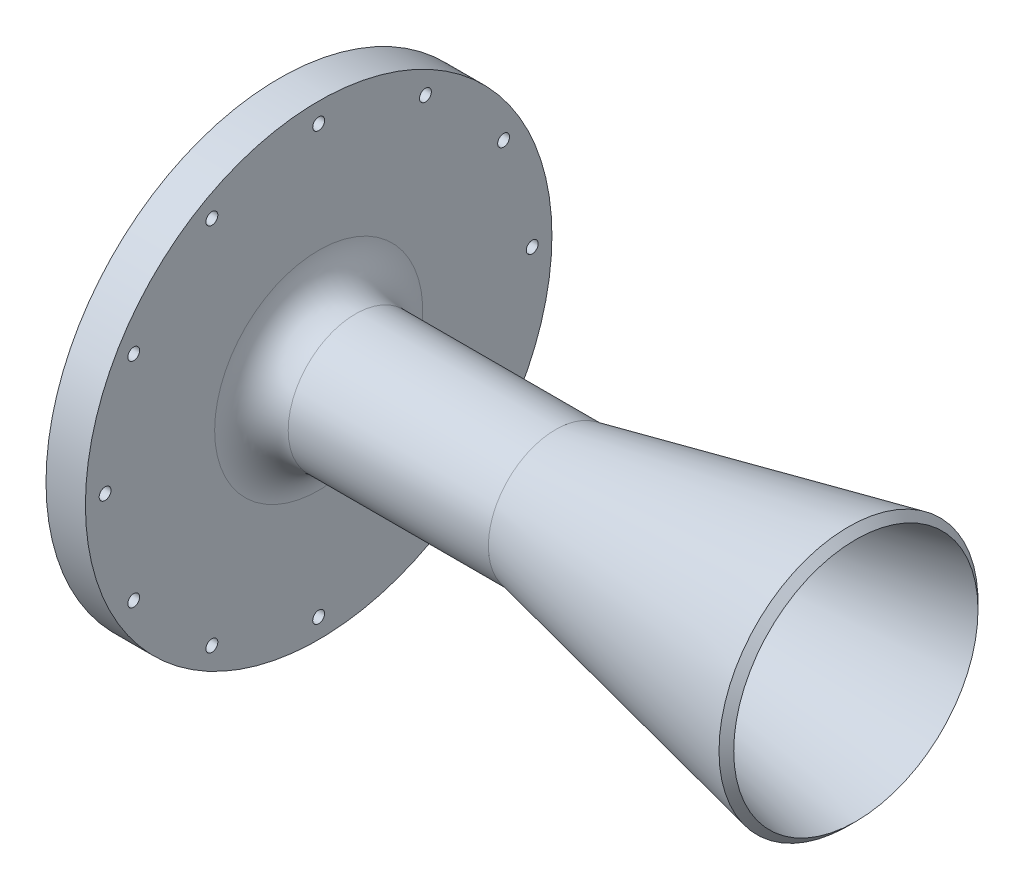
from build123d import *

# Parameters (mm, degrees)
FLANGE_HOLES_D    = 2.8702
DOWEL_HOLES_D     = 4.7625
DOWEL_HOLES_DEPTH = 6.35
DOWEL_HOLES_TIP   = 1.430799349
FILLET1_R         = 8.89
CHAMFER1_SIZE     = 2.141545552
CHAMFER1_SIZE_2   = 2.54


with BuildPart() as part:
    # Sketch2 → Main Structure (revolve)
    with BuildSketch(Plane.XY, mode=Mode.PRIVATE) as main_structure_sk:
        Polygon((0, 20.583496156), (0, 56.388), (9.525, 56.388), (9.525, 16.256), (66.806461084, 16.256), (139.7, 31.75), (139.7, 29.592458901), (60.325, 12.720781818), (60.325, 14.351), (10.795, 14.351), align=None)
    revolve(main_structure_sk.sketch.rotate(Axis((0, 0, 0), (1, 0, 0)), 90), axis=Axis((0, 0, 0), (1, 0, 0)))

    # Flange Holes (through all)
    with Locations(Plane.ZY):
        with Locations((0, -51.6255), (-25.81275, -44.708994483), (-44.708994483, -25.81275), (-51.6255, 0), (-44.708994483, 25.81275), (-25.81275, 44.708994483), (0, 51.6255), (25.81275, 44.708994483), (44.708994483, 25.81275), (51.6255, 0), (44.708994483, -25.81275), (25.81275, -44.708994483)):
            Hole(FLANGE_HOLES_D / 2)

    # Dowel Holes
    with Locations(Plane.ZY):
        with Locations((49.866403745, -13.361662613), (-49.866403745, 13.361662613)):
            Hole(DOWEL_HOLES_D / 2, depth=DOWEL_HOLES_DEPTH)
            with Locations((0, 0, -(DOWEL_HOLES_DEPTH + DOWEL_HOLES_TIP / 2))):  # 118° drill point
                Cone(0, DOWEL_HOLES_D / 2, DOWEL_HOLES_TIP, mode=Mode.SUBTRACT)

    # Fillet1
    fillet1_edges = [part.edges().sort_by_distance(p)[0] for p in [
        (9.525, 0, -16.256),
    ]]
    fillet(fillet1_edges, radius=FILLET1_R)

    # Sketch13 → Cut-Revolve1 (revolve, cut)
    with BuildSketch(Plane(origin=(0, 0, 0), x_dir=(1, 0, 0), z_dir=(0, 1, 0)), mode=Mode.PRIVATE) as cut_revolve1_sk:
        Polygon((0, 38.1), (3.33331808, 0), (0, 0), align=None)
    revolve(cut_revolve1_sk.sketch.rotate(Axis((3.33331808, 0, 0), (-1, 0, 0)), 180), axis=Axis((3.33331808, 0, 0), (-1, 0, 0)), mode=Mode.SUBTRACT)

    # Chamfer1
    # the kernel refuses this chamfer: 2.54, 2.141545552 mm, written as the material it takes off along each edge
    with BuildSketch(Plane(origin=(139.7, 0, 0), x_dir=(0, 0, 1), z_dir=(0, 1, 0))) as chamfer1_piece_1:
        Polygon((31.75 - CHAMFER1_SIZE * 0.207911690799, -CHAMFER1_SIZE * 0.978147600645), (31.75 - CHAMFER1_SIZE_2, 0), (31.75, 0), align=None)
    revolve(axis=Axis((139.7, 0, 0), (1, 0, 0)), mode=Mode.SUBTRACT)


solid = part.part
